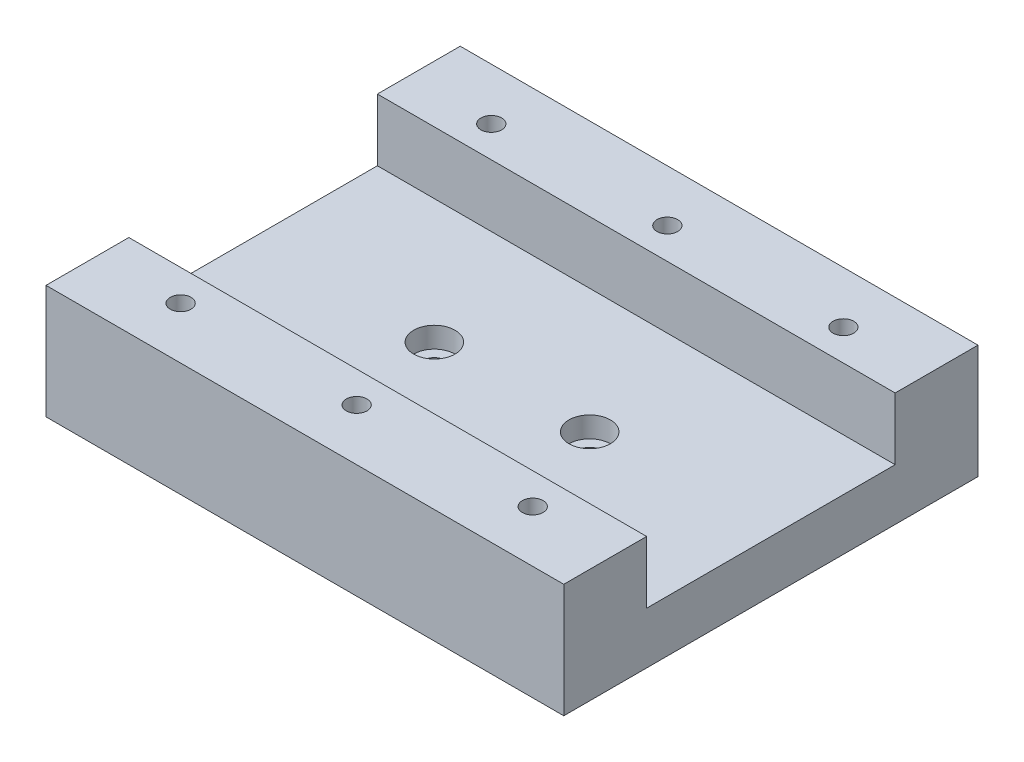
from build123d import *

# Parameters (mm, degrees)
SKETCH1_W               = 50
SKETCH1_H               = 40
BOSS_EXTRUDE1_DEPTH     = 5
SKETCH2_R               = 1
CUT_EXTRUDE1_DEPTH      = 33.403703492
SKETCH3_R               = 2
CUT_EXTRUDE2_DEPTH      = 2
SKETCH5_W               = 50
SKETCH5_H               = 8
BOSS_EXTRUDE2_DEPTH     = 6
CUT_EXTRUDE3_DEPTH      = 33.57299495
CUT_EXTRUDE3_DEPTH_BACK = 33.57299495
SKETCH4_R               = 1


with BuildPart() as part:
    # Sketch1 → Boss-Extrude1 (new body)
    with BuildSketch(Plane(origin=(0, 0, 0), x_dir=(1, 0, 0), z_dir=(0, 1, 0))):
        Rectangle(SKETCH1_W, SKETCH1_H)
    extrude(amount=BOSS_EXTRUDE1_DEPTH)

    # Sketch2 → Cut-Extrude1 (cut, through all)
    with BuildSketch(Plane(origin=(0, 5, 0), x_dir=(1, 0, 0), z_dir=(0, 1, 0))):
        with Locations((-7.5, 0)):
            Circle(SKETCH2_R)
        with Locations((7.5, 0)):
            Circle(SKETCH2_R)
    extrude(amount=-CUT_EXTRUDE1_DEPTH, mode=Mode.SUBTRACT)

    # Sketch3 → Cut-Extrude2 (cut)
    with BuildSketch(Plane(origin=(0, 5, 0), x_dir=(1, 0, 0), z_dir=(0, 1, 0))):
        with Locations((-7.5, 0)):
            Circle(SKETCH3_R)
        with Locations((7.5, 0)):
            Circle(SKETCH3_R)
    extrude(amount=-CUT_EXTRUDE2_DEPTH, mode=Mode.SUBTRACT)

    # Sketch5 → Boss-Extrude2 (add)
    with BuildSketch(Plane(origin=(0, 5, 0), x_dir=(1, 0, 0), z_dir=(0, 1, 0))):
        with Locations((0, 16)):
            Rectangle(SKETCH5_W, SKETCH5_H)
        with Locations((0, -16)):
            Rectangle(SKETCH5_W, SKETCH5_H)
    extrude(amount=BOSS_EXTRUDE2_DEPTH)

    # Sketch4 → Cut-Extrude3 (cut, two sides: drawn at the far end of the back side and taken through both)
    with BuildSketch(Plane(origin=(0, 5, 0), x_dir=(1, 0, 0), z_dir=(0, 1, 0)).offset(-CUT_EXTRUDE3_DEPTH_BACK)):
        with Locations((-17, 15)):
            Circle(SKETCH4_R)
        with Locations((0, 15)):
            Circle(SKETCH4_R)
        with Locations((17, 15)):
            Circle(SKETCH4_R)
        with Locations((-17, -15)):
            Circle(SKETCH4_R)
        with Locations((0, -15)):
            Circle(SKETCH4_R)
        with Locations((17, -15)):
            Circle(SKETCH4_R)
    extrude(amount=CUT_EXTRUDE3_DEPTH + CUT_EXTRUDE3_DEPTH_BACK, mode=Mode.SUBTRACT)


solid = part.part
